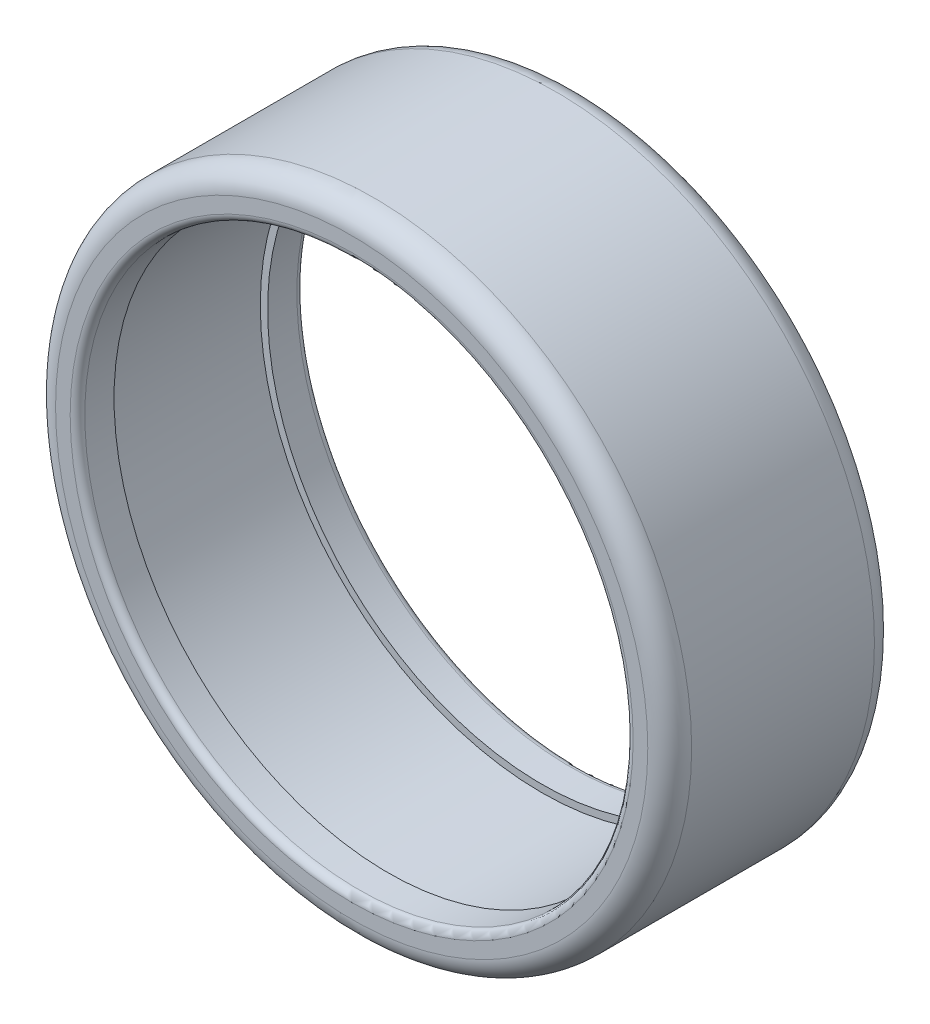
from build123d import *

# Parameters (mm, degrees)
SKETCH1_R           = 43.5
SKETCH1_R_2         = 37.5
EXTRUDE_THIN3_DEPTH = 31
FILLET5_R           = 3
FILLET6_R           = 1
SHELL4_START        = 5
SHELL4_OUTLINE_R    = 38.5
SHELL4_OUTLINE_R_2  = 37.5
SHELL4_DEPTH        = 21


# Read off the part's stored shape, not the designer's step: Shell4
with BuildPart() as part:
    # Sketch1 → Extrude-Thin3 (new body)
    with BuildSketch(Plane.XY):
        Circle(SKETCH1_R)
        Circle(SKETCH1_R_2, mode=Mode.SUBTRACT)
    extrude(amount=EXTRUDE_THIN3_DEPTH)

    # Fillet5
    fillet5_edges = [part.edges().sort_by_distance(p)[0] for p in [
        (-43.5, 0, 0),
        (-43.5, 0, 31),
    ]]
    fillet(fillet5_edges, radius=FILLET5_R)

    # Fillet6
    fillet6_edges = [part.edges().sort_by_distance(p)[0] for p in [
        (-37.5, 0, 0),
        (-37.5, 0, 31),
    ]]
    fillet(fillet6_edges, radius=FILLET6_R)

    # Shell4 outline → Shell4 (cut)
    with BuildSketch(Plane.XY.offset(SHELL4_START)):
        Circle(SHELL4_OUTLINE_R)
        Circle(SHELL4_OUTLINE_R_2, mode=Mode.SUBTRACT)
    extrude(amount=SHELL4_DEPTH, mode=Mode.SUBTRACT)


solid = part.part
